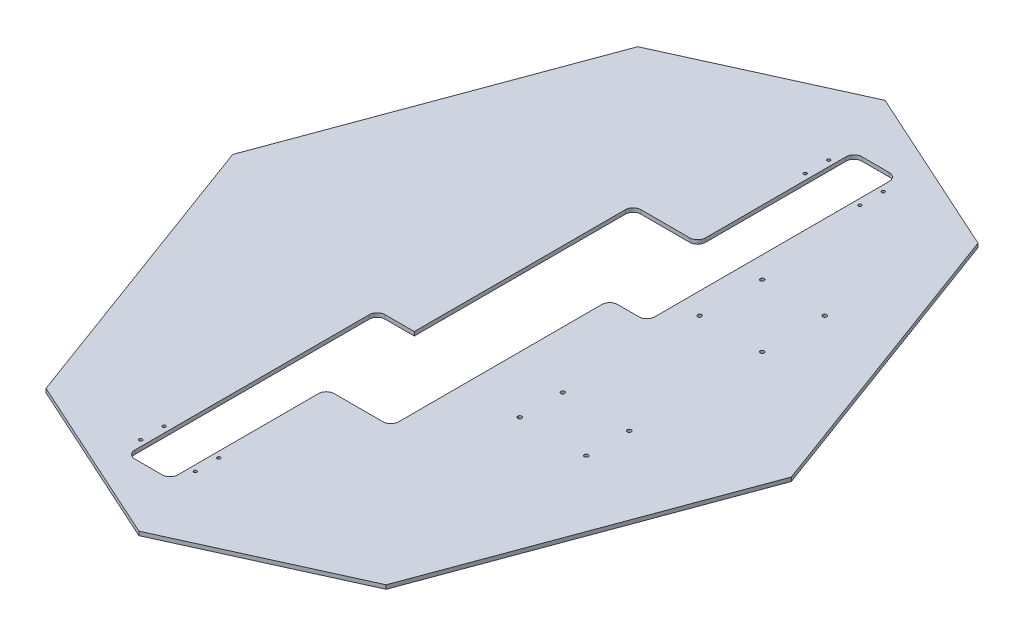
from build123d import *

# Parameters (mm, degrees)
BOSS_EXTRUDE1_DEPTH     = 3.175
CUT_EXTRUDE1_DEPTH      = 758.18700012
CUT_EXTRUDE1_DEPTH_BACK = 758.18700012
SKETCH2_R               = 2.54
FILLET1_R               = 12.7
CUT_EXTRUDE3_REACH      = 759.207
SKETCH4_R               = 3.175


with BuildPart() as part:
    # Sketch1 → Boss-Extrude1 (new, symmetric)
    with BuildSketch(Plane(origin=(0, 0, 0), x_dir=(1, 0, 0), z_dir=(0, 1, 0))):
        Polygon((-276.369998818, 480.707209327), (-453.815592601, 0), (-276.369998818, -480.707209327), (0, -606.11342209), (276.369998818, -480.707209327), (453.815592601, 0), (276.369998818, 480.707209327), (0, 606.11342209), align=None)
    extrude(amount=BOSS_EXTRUDE1_DEPTH, both=True)

    # Sketch2 → Cut-Extrude1 (cut, two sides: drawn at the far end of the back side and taken through both)
    with BuildSketch(Plane(origin=(0, 0, 0), x_dir=(1, 0, 0), z_dir=(0, 1, 0)).offset(-CUT_EXTRUDE1_DEPTH_BACK)):
        Polygon((47.625, 254), (-57.15, 254), (-57.15, -101.6), (-117.475, -101.6), (-117.475, -508), (-47.625, -508), (-47.625, -254), (57.15, -254), (57.15, 101.6), (117.475, 101.6), (117.475, 508), (47.625, 508), align=None)
        with Locations((38.1, 476.25)):
            Circle(SKETCH2_R)
        with Locations((38.1, 438.15)):
            Circle(SKETCH2_R)
        with Locations((127, 438.15)):
            Circle(SKETCH2_R)
        with Locations((127, 476.25)):
            Circle(SKETCH2_R)
        with Locations((-127, -438.15)):
            Circle(SKETCH2_R)
        with Locations((-127, -476.25)):
            Circle(SKETCH2_R)
        with Locations((-38.1, -476.25)):
            Circle(SKETCH2_R)
        with Locations((-38.1, -438.15)):
            Circle(SKETCH2_R)
    extrude(amount=CUT_EXTRUDE1_DEPTH + CUT_EXTRUDE1_DEPTH_BACK, mode=Mode.SUBTRACT)

    # Fillet1
    fillet1_edges = [part.edges().sort_by_distance(p)[0] for p in [
        (-117.475, 0, 508),
        (47.625, 0, -508),
        (117.475, 0, -508),
        (117.475, 0, -101.6),
        (-117.475, 0, 101.6),
        (-47.625, 0, 508),
        (-47.625, 0, 254),
        (57.15, 0, 254),
        (57.15, 0, -101.6),
        (-57.15, 0, -254),
        (47.625, 0, -254),
    ]]
    fillet(fillet1_edges, radius=FILLET1_R)

    # Sketch4 → Cut-Extrude3 (cut, up to next)
    with BuildSketch(Plane(origin=(0, 3.175, 0), x_dir=(1, 0, 0), z_dir=(0, 1, 0)), mode=Mode.PRIVATE) as cut_extrude3_sk1:
        with Locations((257.175, -66.675)):
            Circle(SKETCH4_R)
    cut_extrude3_tool1 = extrude(cut_extrude3_sk1.sketch, amount=-CUT_EXTRUDE3_REACH, mode=Mode.PRIVATE) & part.part
    # Sketch4 → Cut-Extrude3 (cut, up to next)
    with BuildSketch(Plane(origin=(0, 3.175, 0), x_dir=(1, 0, 0), z_dir=(0, 1, 0)), mode=Mode.PRIVATE) as cut_extrude3_sk2:
        with Locations((149.225, -66.675)):
            Circle(SKETCH4_R)
    cut_extrude3_tool2 = extrude(cut_extrude3_sk2.sketch, amount=-CUT_EXTRUDE3_REACH, mode=Mode.PRIVATE) & part.part
    # Sketch4 → Cut-Extrude3 (cut, up to next)
    with BuildSketch(Plane(origin=(0, 3.175, 0), x_dir=(1, 0, 0), z_dir=(0, 1, 0)), mode=Mode.PRIVATE) as cut_extrude3_sk3:
        with Locations((149.225, -136.525)):
            Circle(SKETCH4_R)
    cut_extrude3_tool3 = extrude(cut_extrude3_sk3.sketch, amount=-CUT_EXTRUDE3_REACH, mode=Mode.PRIVATE) & part.part
    # Sketch4 → Cut-Extrude3 (cut, up to next)
    with BuildSketch(Plane(origin=(0, 3.175, 0), x_dir=(1, 0, 0), z_dir=(0, 1, 0)), mode=Mode.PRIVATE) as cut_extrude3_sk4:
        with Locations((257.175, -136.525)):
            Circle(SKETCH4_R)
    cut_extrude3_tool4 = extrude(cut_extrude3_sk4.sketch, amount=-CUT_EXTRUDE3_REACH, mode=Mode.PRIVATE) & part.part
    # Sketch4 → Cut-Extrude3 (cut, up to next)
    with BuildSketch(Plane(origin=(0, 3.175, 0), x_dir=(1, 0, 0), z_dir=(0, 1, 0)), mode=Mode.PRIVATE) as cut_extrude3_sk5:
        with Locations((152.4, 254)):
            Circle(SKETCH4_R)
    cut_extrude3_tool5 = extrude(cut_extrude3_sk5.sketch, amount=-CUT_EXTRUDE3_REACH, mode=Mode.PRIVATE) & part.part
    # Sketch4 → Cut-Extrude3 (cut, up to next)
    with BuildSketch(Plane(origin=(0, 3.175, 0), x_dir=(1, 0, 0), z_dir=(0, 1, 0)), mode=Mode.PRIVATE) as cut_extrude3_sk6:
        with Locations((254, 254)):
            Circle(SKETCH4_R)
    cut_extrude3_tool6 = extrude(cut_extrude3_sk6.sketch, amount=-CUT_EXTRUDE3_REACH, mode=Mode.PRIVATE) & part.part
    # Sketch4 → Cut-Extrude3 (cut, up to next)
    with BuildSketch(Plane(origin=(0, 3.175, 0), x_dir=(1, 0, 0), z_dir=(0, 1, 0)), mode=Mode.PRIVATE) as cut_extrude3_sk7:
        with Locations((254, 152.4)):
            Circle(SKETCH4_R)
    cut_extrude3_tool7 = extrude(cut_extrude3_sk7.sketch, amount=-CUT_EXTRUDE3_REACH, mode=Mode.PRIVATE) & part.part
    # Sketch4 → Cut-Extrude3 (cut, up to next)
    with BuildSketch(Plane(origin=(0, 3.175, 0), x_dir=(1, 0, 0), z_dir=(0, 1, 0)), mode=Mode.PRIVATE) as cut_extrude3_sk8:
        with Locations((152.4, 152.4)):
            Circle(SKETCH4_R)
    cut_extrude3_tool8 = extrude(cut_extrude3_sk8.sketch, amount=-CUT_EXTRUDE3_REACH, mode=Mode.PRIVATE) & part.part
    add(cut_extrude3_tool1.solids().sort_by_distance((257.175, 3.175, 66.675))[0], mode=Mode.SUBTRACT)
    add(cut_extrude3_tool2.solids().sort_by_distance((149.225, 3.175, 66.675))[0], mode=Mode.SUBTRACT)
    add(cut_extrude3_tool3.solids().sort_by_distance((149.225, 3.175, 136.525))[0], mode=Mode.SUBTRACT)
    add(cut_extrude3_tool4.solids().sort_by_distance((257.175, 3.175, 136.525))[0], mode=Mode.SUBTRACT)
    add(cut_extrude3_tool5.solids().sort_by_distance((152.4, 3.175, -254))[0], mode=Mode.SUBTRACT)
    add(cut_extrude3_tool6.solids().sort_by_distance((254, 3.175, -254))[0], mode=Mode.SUBTRACT)
    add(cut_extrude3_tool7.solids().sort_by_distance((254, 3.175, -152.4))[0], mode=Mode.SUBTRACT)
    add(cut_extrude3_tool8.solids().sort_by_distance((152.4, 3.175, -152.4))[0], mode=Mode.SUBTRACT)


solid = part.part
